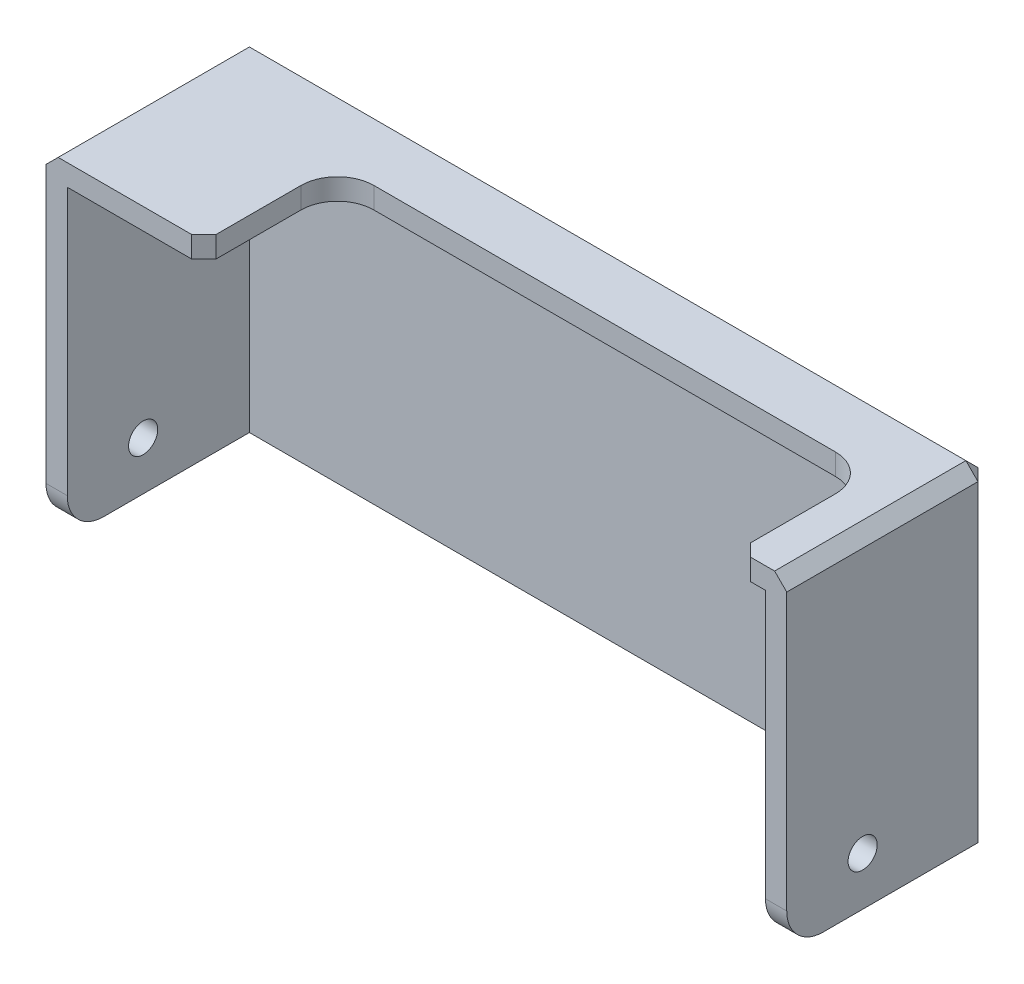
from build123d import *

# Parameters (mm, degrees)
SKETCH1_W            = 115
SKETCH1_H            = 50
BOSS_EXTRUDE1_DEPTH  = 30
SKETCH2_W            = 88
SKETCH2_H            = 22
CUT_EXTRUDE1_DEPTH   = 82.891696771
SHELL1_T             = 3.5
M4_CLEARANCE_HOLE1_D = 4.8
CHAMFER1_SIZE        = 2
FILLET1_R            = 6
FILLET2_R            = 6


with BuildPart() as part:
    # Sketch1 → Boss-Extrude1 (new body)
    with BuildSketch(Plane.XY):
        Rectangle(SKETCH1_W, SKETCH1_H)
    extrude(amount=BOSS_EXTRUDE1_DEPTH)

    # Sketch2 → Cut-Extrude1 (cut, through all)
    with BuildSketch(Plane(origin=(0, 25, 0), x_dir=(1, 0, 0), z_dir=(0, 1, 0))):
        with Locations((9, -19)):
            Rectangle(SKETCH2_W, SKETCH2_H)
    extrude(amount=-CUT_EXTRUDE1_DEPTH, mode=Mode.SUBTRACT)

    # Shell1
    shell1_openings = [part.faces().sort_by_distance(p)[0] for p in [
        (-35, 0, 19),
        (9, 0, 8),
        (53, 0, 19),
        (55.25, 0, 30),
        (0, -25, 1.188486432),
        (-46.25, 0, 30),
    ]]
    offset(amount=SHELL1_T, openings=shell1_openings, kind=Kind.INTERSECTION)

    # M4 Clearance Hole1 (through all)
    with Locations(Plane.ZY.offset(61)):
        with Locations((17.5, -17)):
            Hole(M4_CLEARANCE_HOLE1_D / 2)

    # Chamfer1
    chamfer1_edges = [part.edges().sort_by_distance(p)[0] for p in [
        (0, 28.5, -3.5),
        (61, 28.5, 13.25),
        (61, 1.75, -3.5),
        (0, -25, -3.5),
        (-61, 1.75, -3.5),
        (-61, 28.5, 13.25),
        (53, 26.75, 30),
        (-35, 26.75, 30),
    ]]
    chamfer(chamfer1_edges, length=CHAMFER1_SIZE)

    # Fillet1
    fillet1_edges = [part.edges().sort_by_distance(p)[0] for p in [
        (-35, 26.75, 8),
        (53, 26.75, 8),
    ]]
    fillet(fillet1_edges, radius=FILLET1_R)

    # Fillet2
    fillet2_edges = [part.edges().sort_by_distance(p)[0] for p in [
        (59.25, -25, 30),
        (-59.25, -25, 30),
    ]]
    fillet(fillet2_edges, radius=FILLET2_R)


solid = part.part
